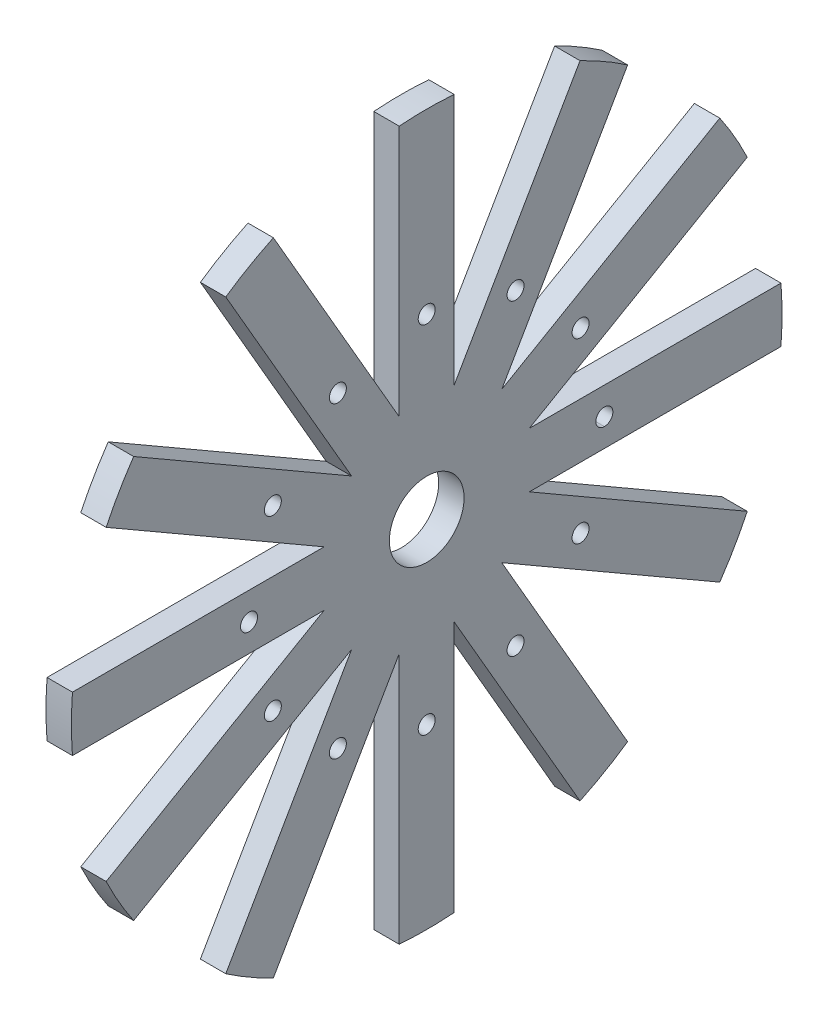
from build123d import *

# Parameters (mm, degrees)
SKETCH1_W           = 450
SKETCH1_H           = 450
BOSS_EXTRUDE1_DEPTH = 5
BOSS_EXTRUDE2_DEPTH = 7.48
BOSS_EXTRUDE3_DEPTH = 7.48
SKETCH6_W           = 450
SKETCH6_H           = 450
CUT_EXTRUDE1_DEPTH  = 5
SKETCH7_R           = 11
SKETCH7_R_2         = 2.5
CUT_EXTRUDE2_DEPTH  = 10
SKETCH8_R           = 209.3091
SKETCH8_R_2         = 104.5891
CUT_EXTRUDE3_DEPTH  = 10
BOSS_EXTRUDE4_DEPTH = 7.48
SKETCH11_R          = 2.5
CUT_EXTRUDE5_DEPTH  = 10
SKETCH12_R          = 20.73675099
SKETCH12_R_2        = 11
BOSS_EXTRUDE5_DEPTH = 7.48


# Read off the part's stored shape, not the designer's step: Boss-Extrude2
with BuildPart() as part:
    # Sketch1 → Boss-Extrude1 (new body)
    with BuildSketch(Plane(origin=(0, 0, 0), x_dir=(0, 0, -1), z_dir=(1, 0, 0))):
        Rectangle(SKETCH1_W, SKETCH1_H)
    extrude(amount=BOSS_EXTRUDE1_DEPTH)

    # Boss-Extrude2 outline → Boss-Extrude2 (add)
    with BuildSketch(Plane(origin=(5, 0, 0), x_dir=(0, 0, -1), z_dir=(1, 0, 0))):
        with BuildLine():
            Line((-164.971757583, 8.09), (-209.152698388, 8.09))
            ThreePointArc((-209.152698388, 8.09), (-209.3091, 0), (-209.152698388, -8.09))
            Line((-209.152698388, -8.09), (-164.971757583, -8.09))
            ThreePointArc((-164.971757583, -8.09), (-116.792827049, -116.792827049), (-8.09, -164.971757583))
            Line((-8.09, -164.971757583), (-8.09, -209.152698388))
            ThreePointArc((-8.09, -209.152698388), (0, -209.3091), (8.09, -209.152698388))
            Line((8.09, -209.152698388), (8.09, -164.971757583))
            ThreePointArc((8.09, -164.971757583), (116.792827049, -116.792827049), (164.971757583, -8.09))
            Line((164.971757583, -8.09), (209.152698388, -8.09))
            ThreePointArc((209.152698388, -8.09), (209.3091, 0), (209.152698388, 8.09))
            Line((209.152698388, 8.09), (164.971757583, 8.09))
            ThreePointArc((164.971757583, 8.09), (116.792827049, 116.792827049), (8.09, 164.971757583))
            Line((8.09, 164.971757583), (8.09, 209.152698388))
            ThreePointArc((8.09, 209.152698388), (0, 209.3091), (-8.09, 209.152698388))
            Line((-8.09, 209.152698388), (-8.09, 164.971757583))
            ThreePointArc((-8.09, 164.971757583), (-116.792827049, 116.792827049), (-164.971757583, 8.09))
        make_face()
        with BuildLine():
            Line((148.770198629, 8.09), (104.538333308, 8.09))
            ThreePointArc((104.538333308, 8.09), (104.8509, 0), (104.538333308, -8.09))
            Line((104.538333308, -8.09), (148.770198629, -8.09))
            ThreePointArc((148.770198629, -8.09), (105.351839329, -105.351839329), (8.09, -148.770198629))
            Line((8.09, -148.770198629), (8.09, -104.538333308))
            ThreePointArc((8.09, -104.538333308), (0, -104.8509), (-8.09, -104.538333308))
            Line((-8.09, -104.538333308), (-8.09, -148.770198629))
            ThreePointArc((-8.09, -148.770198629), (-105.351839329, -105.351839329), (-148.770198629, -8.09))
            Line((-148.770198629, -8.09), (-104.538333308, -8.09))
            ThreePointArc((-104.538333308, -8.09), (-104.8509, 0), (-104.538333308, 8.09))
            Line((-104.538333308, 8.09), (-148.770198629, 8.09))
            ThreePointArc((-148.770198629, 8.09), (-105.351839329, 105.351839329), (-8.09, 148.770198629))
            Line((-8.09, 148.770198629), (-8.09, 104.538333308))
            ThreePointArc((-8.09, 104.538333308), (0, 104.8509), (8.09, 104.538333308))
            Line((8.09, 104.538333308), (8.09, 148.770198629))
            ThreePointArc((8.09, 148.770198629), (105.351839329, 105.351839329), (148.770198629, 8.09))
        make_face(mode=Mode.SUBTRACT)
    extrude(amount=BOSS_EXTRUDE2_DEPTH)

    # Sketch5 → Boss-Extrude3 (add)
    with BuildSketch(Plane(origin=(5, 0, 0), x_dir=(0, 0, -1), z_dir=(1, 0, 0))):
        with BuildLine():
            Line((-19.319547743, 8.09), (-104.275748565, 8.09))
            ThreePointArc((-104.275748565, 8.09), (-104.5891, 0), (-104.275748565, -8.09))
            Line((-104.275748565, -8.09), (-19.319547743, -8.09))
            ThreePointArc((-19.319547743, -8.09), (0, -20.945), (19.319547743, -8.09))
            Line((19.319547743, -8.09), (104.275748565, -8.09))
            ThreePointArc((104.275748565, -8.09), (104.5891, 0), (104.275748565, 8.09))
            Line((104.275748565, 8.09), (19.319547743, 8.09))
            ThreePointArc((19.319547743, 8.09), (0, 20.945), (-19.319547743, 8.09))
        make_face()
    extrude(amount=BOSS_EXTRUDE3_DEPTH)

    # Sketch6 → Cut-Extrude1 (cut)
    with BuildSketch(Plane.ZY):
        Rectangle(SKETCH6_W, SKETCH6_H)
    extrude(amount=-CUT_EXTRUDE1_DEPTH, mode=Mode.SUBTRACT)


with BuildPart() as cut_extrude1_piece_1:
    # of the separate pieces the step leaves, piece 1, a body of its own (cut_extrude1_pieces)
    add(part.part.solids().sort_by_distance((5, 209.152698388, 8.09))[0])


with BuildPart() as cut_extrude1_piece_2:
    # of the separate pieces the step leaves, piece 2, a body of its own (cut_extrude1_pieces)
    add(part.part.solids().sort_by_distance((5, 8.09, -104.275748565))[0])


with BuildPart() as cut_extrude2_tool:
    # Sketch7 → Cut-Extrude2 (new body)
    with BuildSketch(Plane(origin=(12.48, 0, 0), x_dir=(0, 0, -1), z_dir=(1, 0, 0))):
        Circle(SKETCH7_R)
        with Locations((-183.1891, 0)):
            Circle(SKETCH7_R_2)
        with Locations((-130.9659, 0)):
            Circle(SKETCH7_R_2)
        with Locations((0, -183.1891)):
            Circle(SKETCH7_R_2)
        with Locations((0, -130.9659)):
            Circle(SKETCH7_R_2)
        with Locations((183.1891, 0)):
            Circle(SKETCH7_R_2)
        with Locations((52.3, 0)):
            Circle(SKETCH7_R_2)
        with Locations((-52.295, 0)):
            Circle(SKETCH7_R_2)
        with Locations((0, 183.1891)):
            Circle(SKETCH7_R_2)
        with Locations((0, 130.9659)):
            Circle(SKETCH7_R_2)
        with BuildLine():
            Line((-3, 13.8), (-3, 10.583005244))
            ThreePointArc((-3, 10.583005244), (0, 11), (3, 10.583005244))
            Line((3, 10.583005244), (3, 13.8))
            Line((3, 13.8), (-3, 13.8))
        make_face()
        with BuildLine():
            ThreePointArc((3, -10.583005244), (0, -11), (-3, -10.583005244))
            Line((-3, -10.583005244), (-3, -13.8))
            Line((-3, -13.8), (3, -13.8))
            Line((3, -13.8), (3, -10.583005244))
        make_face()
        with Locations((130.9659, 0)):
            Circle(SKETCH7_R_2)
    extrude(amount=-CUT_EXTRUDE2_DEPTH)


with BuildPart() as cut_extrude1_piece_1_1:
    add(cut_extrude1_piece_1.part)

    # Cut-Extrude2: cut by cut_extrude2_tool
    add(cut_extrude2_tool.part, mode=Mode.SUBTRACT)

    # Sketch8 → Cut-Extrude3 (cut)
    with BuildSketch(Plane(origin=(12.48, 0, 0), x_dir=(0, 0, -1), z_dir=(1, 0, 0))):
        Circle(SKETCH8_R)
        Circle(SKETCH8_R_2, mode=Mode.SUBTRACT)
    extrude(amount=-CUT_EXTRUDE3_DEPTH, mode=Mode.SUBTRACT)


with BuildPart() as cut_extrude1_piece_2_1:
    add(cut_extrude1_piece_2.part)

    # Cut-Extrude2: cut by cut_extrude2_tool
    add(cut_extrude2_tool.part, mode=Mode.SUBTRACT)

    # Sketch9 → Boss-Extrude4 (add)
    with BuildSketch(Plane(origin=(12.48, 0, 0), x_dir=(0, 0, -1), z_dir=(1, 0, 0))):
        with BuildLine():
            Line((-94.350447256, 45.131728766), (-30.192291033, 8.09))
            Line((-30.192291033, 8.09), (-19.319547743, 8.09))
            ThreePointArc((-19.319547743, 8.09), (0, 20.945), (19.319547743, 8.09))
            Line((19.319547743, 8.09), (30.192291033, 8.09))
            Line((30.192291033, 8.09), (94.350447256, 45.131728766))
            ThreePointArc((94.350447256, 45.131728766), (90.576817559, 52.29455), (86.260447256, 59.144019799))
            Line((86.260447256, 59.144019799), (22.102291033, 22.102291033))
            Line((22.102291033, 22.102291033), (59.144019799, 86.260447256))
            ThreePointArc((59.144019799, 86.260447256), (52.29455, 90.576817559), (45.131728766, 94.350447256))
            Line((45.131728766, 94.350447256), (8.09, 30.192291033))
            Line((8.09, 30.192291033), (8.09, 104.275748565))
            ThreePointArc((8.09, 104.275748565), (0, 104.5891), (-8.09, 104.275748565))
            Line((-8.09, 104.275748565), (-8.09, 30.192291033))
            Line((-8.09, 30.192291033), (-45.131728766, 94.350447256))
            ThreePointArc((-45.131728766, 94.350447256), (-52.29455, 90.576817559), (-59.144019799, 86.260447256))
            Line((-59.144019799, 86.260447256), (-22.102291033, 22.102291033))
            Line((-22.102291033, 22.102291033), (-86.260447256, 59.144019799))
            ThreePointArc((-86.260447256, 59.144019799), (-90.576817559, 52.29455), (-94.350447256, 45.131728766))
        make_face()
        with BuildLine():
            ThreePointArc((19.319547743, -8.09), (0, -20.945), (-19.319547743, -8.09))
            Line((-19.319547743, -8.09), (-30.192291033, -8.09))
            Line((-30.192291033, -8.09), (-94.350447256, -45.131728766))
            ThreePointArc((-94.350447256, -45.131728766), (-90.576817559, -52.29455), (-86.260447256, -59.144019799))
            Line((-86.260447256, -59.144019799), (-22.102291033, -22.102291033))
            Line((-22.102291033, -22.102291033), (-59.144019799, -86.260447256))
            ThreePointArc((-59.144019799, -86.260447256), (-52.29455, -90.576817559), (-45.131728766, -94.350447256))
            Line((-45.131728766, -94.350447256), (-8.09, -30.192291033))
            Line((-8.09, -30.192291033), (-8.09, -104.275748565))
            ThreePointArc((-8.09, -104.275748565), (0, -104.5891), (8.09, -104.275748565))
            Line((8.09, -104.275748565), (8.09, -30.192291033))
            Line((8.09, -30.192291033), (45.131728766, -94.350447256))
            ThreePointArc((45.131728766, -94.350447256), (52.29455, -90.576817559), (59.144019799, -86.260447256))
            Line((59.144019799, -86.260447256), (22.102291033, -22.102291033))
            Line((22.102291033, -22.102291033), (86.260447256, -59.144019799))
            ThreePointArc((86.260447256, -59.144019799), (90.576817559, -52.29455), (94.350447256, -45.131728766))
            Line((94.350447256, -45.131728766), (30.192291033, -8.09))
            Line((30.192291033, -8.09), (19.319547743, -8.09))
        make_face()
    extrude(amount=-BOSS_EXTRUDE4_DEPTH)

    # Sketch11 → Cut-Extrude5 (cut)
    with BuildSketch(Plane(origin=(12.48, 0, 0), x_dir=(0, 0, -1), z_dir=(1, 0, 0))):
        with Locations((-52.295, 0)):
            Circle(SKETCH11_R)
        with Locations((-45.288798491, 26.1475)):
            Circle(SKETCH11_R)
        with Locations((-26.1475, 45.288798491)):
            Circle(SKETCH11_R)
        with Locations((0, 52.295)):
            Circle(SKETCH11_R)
        with Locations((26.1475, 45.288798491)):
            Circle(SKETCH11_R)
        with Locations((45.288798491, 26.1475)):
            Circle(SKETCH11_R)
        with Locations((52.295, 0)):
            Circle(SKETCH11_R)
        with Locations((45.288798491, -26.1475)):
            Circle(SKETCH11_R)
        with Locations((26.1475, -45.288798491)):
            Circle(SKETCH11_R)
        with Locations((0, -52.295)):
            Circle(SKETCH11_R)
        with Locations((-26.1475, -45.288798491)):
            Circle(SKETCH11_R)
        with Locations((-45.288798491, -26.1475)):
            Circle(SKETCH11_R)
    extrude(amount=-CUT_EXTRUDE5_DEPTH, mode=Mode.SUBTRACT)

    # Sketch12 → Boss-Extrude5 (add)
    with BuildSketch(Plane(origin=(12.48, 0, 0), x_dir=(0, 0, -1), z_dir=(1, 0, 0))):
        Circle(SKETCH12_R)
        Circle(SKETCH12_R_2, mode=Mode.SUBTRACT)
    extrude(amount=-BOSS_EXTRUDE5_DEPTH)


solid = cut_extrude1_piece_2_1.part
